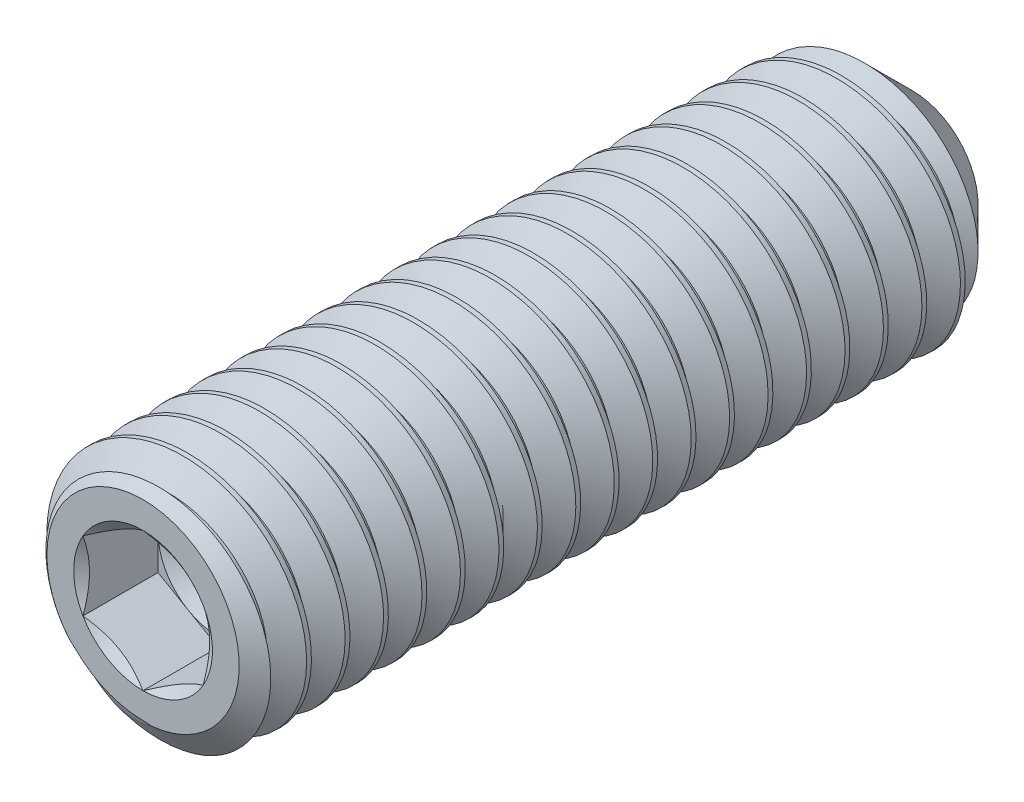
from build123d import *

# Parameters (mm, degrees)
CUT_SWEEP_PITCH   = 0.8
HEX_EXTRUDE_DEPTH = 1.5625


with BuildPart() as part:
    # Body Sketch → Body Revolve (revolve)
    with BuildSketch(Plane(origin=(0, 0, 0), x_dir=(0, 0, -1), z_dir=(1, 0, 0))):
        Polygon((-7.588436834, 0), (-7.588436834, 2), (-7.238333065, 2.5), (7.281475432, 2.5), (8.411563166, 1.369912266), (7.588436834, 0), align=None)
    revolve(axis=Axis((0, 0, -7.588436834), (0, 0, 1)))

    # Cut Sweep: the profile of Cut Sweep Sketch profile screwed along a right-hand helix of 21 turns, 8 arcs to a turn; built about Z, then put on its axis
    cut_sweep_z = Axis((0, 0, 0), (0, 0, 1))
    cut_sweep_corners = [(2.5003, 0, 0.000173205), (2.5003, 0, -0.700173205), (1.980384758, 0, -0.4), (1.980384758, 0, -0.3)]
    with BuildLine(mode=Mode.PRIVATE) as cut_sweep_profile:
        Line(cut_sweep_corners[0], cut_sweep_corners[1])
        Line(cut_sweep_corners[1], cut_sweep_corners[2])
        Line(cut_sweep_corners[2], cut_sweep_corners[3])
        Line(cut_sweep_corners[3], cut_sweep_corners[0])
    cut_sweep_cap = Face(cut_sweep_profile.wire())
    cut_sweep_turn_angles = [0, 22.5, 45, 67.5, 90, 112.5, 135, 157.5, 180, 202.5, 225, 247.5, 270, 292.5, 315, 337.5, 360]
    cut_sweep_turn_weights = [1, 0.9238795325112867, 1, 0.9238795325112867, 1, 0.9238795325112867, 1, 0.9238795325112867, 1, 0.9238795325112867, 1, 0.9238795325112867, 1, 0.9238795325112867, 1, 0.9238795325112867, 1]
    cut_sweep_turn_rails = [Edge.make_bspline([Vector(p[0], p[1], 0).rotate(cut_sweep_z, cut_sweep_turn_angles[k]) / cut_sweep_turn_weights[k] + Vector(0, 0, p[2] + CUT_SWEEP_PITCH * cut_sweep_turn_angles[k] / 360) for k in range(17)], [0, 0, 0, 1, 1, 2, 2, 3, 3, 4, 4, 5, 5, 6, 6, 7, 7, 8, 8, 8], 2, cut_sweep_turn_weights) for p in cut_sweep_corners]
    cut_sweep_turn_sides = [Face.make_surface_from_curves(cut_sweep_turn_rails[p[0]], cut_sweep_turn_rails[p[1]]) for p in [(0, 1), (1, 2), (2, 3), (3, 0)]]
    cut_sweep = Plane(origin=(0, 0, -8.411563166), x_dir=(0, 1, 0), z_dir=(0, 0, 1)) * Solid(Shell([*[p.moved(Location((0, 0, CUT_SWEEP_PITCH * i))) for i in range(21) for p in cut_sweep_turn_sides], cut_sweep_cap, cut_sweep_cap.rotate(cut_sweep_z, 7560).moved(Location((0, 0, CUT_SWEEP_PITCH * 7560 / 360)))]))
    add(cut_sweep, mode=Mode.SUBTRACT)

    # Hex Sketch → Hex Extrude (cut)
    with BuildSketch(Plane.XY.offset(7.588436834)):
        Polygon((0, 1.443375673), (-1.25, 0.721687836), (-1.25, -0.721687836), (0, -1.443375673), (1.25, -0.721687836), (1.25, 0.721687836), align=None)
    extrude(amount=-HEX_EXTRUDE_DEPTH, mode=Mode.SUBTRACT)

    # Hex Entry Extrude cone 1 section (through the dimple's axis) → Hex Entry Extrude (revolve, cut)
    with BuildSketch(Plane(origin=(0, 0, 7.588436834), x_dir=(0, -1, 0), z_dir=(1, 0, 0))):
        Polygon((0, 0), (1.443375673, 0), (0, 1.010662527), align=None)
    revolve(axis=Axis((0, 0, 7.588436834), (0, 0, -1)), mode=Mode.SUBTRACT)

    # Hex Bottom Extrude cone 1 section (through the dimple's axis) → Hex Bottom Extrude (revolve, cut)
    with BuildSketch(Plane(origin=(0, 0, 6.025936834), x_dir=(0, -1, 0), z_dir=(1, 0, 0))):
        Polygon((0, 0), (1.25, 0), (0, 0.721687836), align=None)
    revolve(axis=Axis((0, 0, 6.025936834), (0, 0, -1)), mode=Mode.SUBTRACT)


solid = part.part
